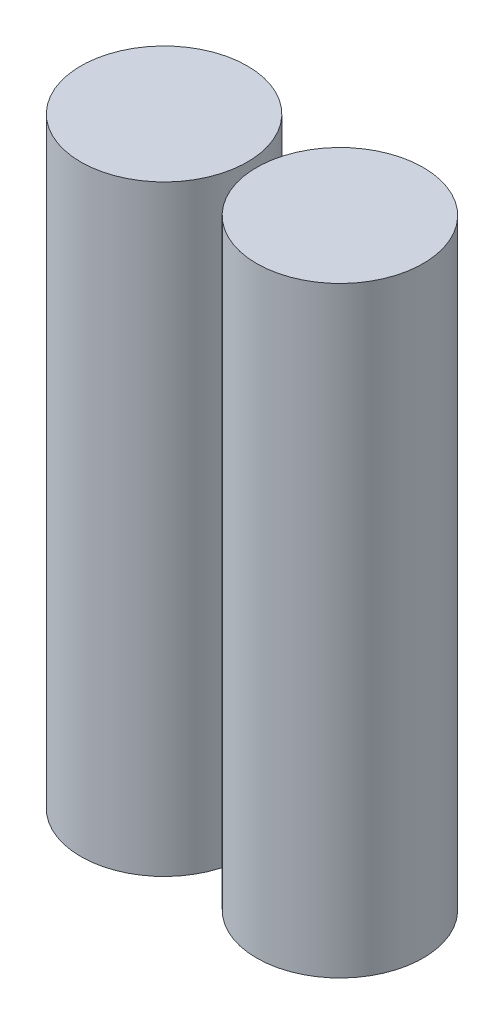
from build123d import *

# Parameters (mm, degrees)
SKETCH1_R             = 9
BOSS_EXTRUDE1_DEPTH   = 65
BOSS_EXTRUDE1_2_DEPTH = 65


with BuildPart() as part:
    # Sketch1 → Boss-Extrude1 (new body)
    with BuildSketch(Plane(origin=(0, 0, 0), x_dir=(1, 0, 0), z_dir=(0, 1, 0))):
        with Locations((19, 0)):
            Circle(SKETCH1_R)
    extrude(amount=BOSS_EXTRUDE1_DEPTH)


with BuildPart() as body_2:
    # Sketch1 → Boss-Extrude1 2 (new body)
    with BuildSketch(Plane(origin=(0, 0, 0), x_dir=(1, 0, 0), z_dir=(0, 1, 0))):
        Circle(SKETCH1_R)
    extrude(amount=BOSS_EXTRUDE1_2_DEPTH)


solid = Compound([part.part, body_2.part])
